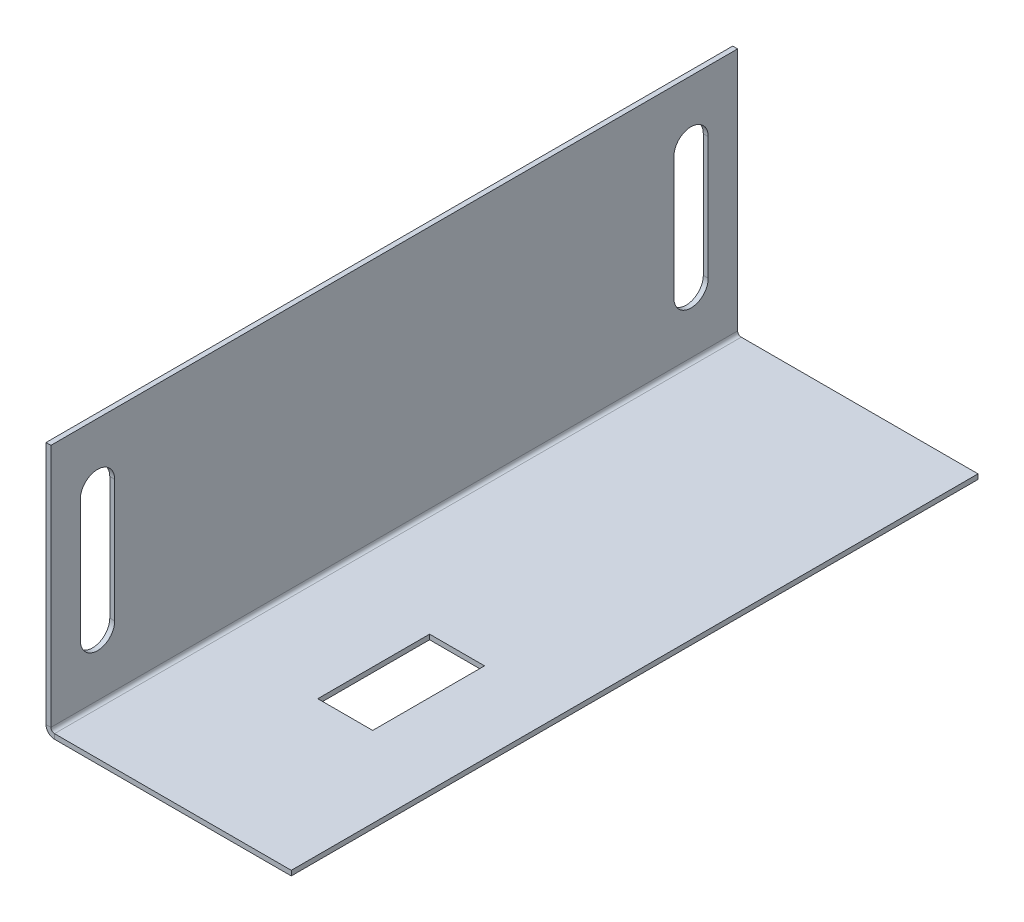
from build123d import *

# Parameters (mm, degrees)
SKETCH1_W              = 100
SKETCH1_H              = 140
BASE_FLANGE1_DEPTH     = 1
SKETCHED_START         = -140
SKETCHED_BEND1_DEPTH   = 140
SKETCHED_BEND1_2_DEPTH = 140
CUT_EXTRUDE1_REACH     = 158.698
CUT_EXTRUDE2_REACH     = 181.598
SKETCH17_W             = 11.2
SKETCH17_H             = 22.8


# Read off the part's stored shape, not the designer's step: Sketched Bend1
# Sheet-metal steps are written as plain solids
with BuildPart() as part:
    # Sketch1 → Base-Flange1 (new body)
    with BuildSketch(Plane(origin=(0, 0, 0), x_dir=(1, 0, 0), z_dir=(0, 1, 0))):
        with Locations((50, 70)):
            Rectangle(SKETCH1_W, SKETCH1_H)
    extrude(amount=-BASE_FLANGE1_DEPTH)

    # Sketched Bend1 outline → Sketched Bend1 (cut)
    with BuildSketch(Plane.XY.offset(SKETCHED_START)):
        with BuildLine():
            ThreePointArc((51.7366, -1), (50.804773836, -0.728828115), (50.16395891, 0))
            Line((50.16395891, 0), (0, 0))
            Line((0, 0), (0, -1))
            Line((0, -1), (51.7366, -1))
        make_face()
    extrude(amount=SKETCHED_BEND1_DEPTH, mode=Mode.SUBTRACT)

    # Sketched Bend1 2 outline → Sketched Bend1 2 (add)
    with BuildSketch(Plane.XY.offset(SKETCHED_START)):
        with BuildLine():
            Line((51, 50.530753262), (50, 50.530753262))
            Line((50, 50.530753262), (50, 0.7366))
            ThreePointArc((50, 0.7366), (50.041485243, 0.359286442), (50.16395891, 0))
            Line((50.16395891, 0), (51.7366, 0))
            ThreePointArc((51.7366, 0), (51.215745145, 0.215745145), (51, 0.7366))
            Line((51, 0.7366), (51, 50.530753262))
        make_face()
    extrude(amount=SKETCHED_BEND1_2_DEPTH)

    # Sketch14 → Cut-Extrude1 (cut, up to next)
    with BuildSketch(Plane(origin=(51, 0, 0), x_dir=(0, 0, -1), z_dir=(1, 0, 0)), mode=Mode.PRIVATE) as cut_extrude1_sk1:
        with BuildLine():
            Line((13, 38.030753262), (13, 13.030753262))
            ThreePointArc((13, 13.030753262), (9.5, 9.530753262), (6, 13.030753262))
            Line((6, 13.030753262), (6, 38.030753262))
            ThreePointArc((6, 38.030753262), (9.5, 41.530753262), (13, 38.030753262))
        make_face()
    cut_extrude1_tool1 = extrude(cut_extrude1_sk1.sketch, amount=-CUT_EXTRUDE1_REACH, mode=Mode.PRIVATE) & part.part
    # Sketch14 → Cut-Extrude1 (cut, up to next)
    with BuildSketch(Plane(origin=(51, 0, 0), x_dir=(0, 0, -1), z_dir=(1, 0, 0)), mode=Mode.PRIVATE) as cut_extrude1_sk2:
        with BuildLine():
            Line((127, 38.030753262), (127, 13.030753262))
            ThreePointArc((127, 13.030753262), (130.5, 9.530753262), (134, 13.030753262))
            Line((134, 13.030753262), (134, 38.030753262))
            ThreePointArc((134, 38.030753262), (130.5, 41.530753262), (127, 38.030753262))
        make_face()
    cut_extrude1_tool2 = extrude(cut_extrude1_sk2.sketch, amount=-CUT_EXTRUDE1_REACH, mode=Mode.PRIVATE) & part.part
    add(cut_extrude1_tool1.solids().sort_by_distance((51, 25.530753, -9.5))[0], mode=Mode.SUBTRACT)
    add(cut_extrude1_tool2.solids().sort_by_distance((51, 25.530753, -130.5))[0], mode=Mode.SUBTRACT)

    # Sketch17 → Cut-Extrude2 (cut, up to next)
    with BuildSketch(Plane.XZ.offset(1), mode=Mode.PRIVATE) as cut_extrude2_sk1:
        with Locations((78, -44.4)):
            Rectangle(SKETCH17_W, SKETCH17_H)
    cut_extrude2_tool1 = extrude(cut_extrude2_sk1.sketch, amount=-CUT_EXTRUDE2_REACH, mode=Mode.PRIVATE) & part.part
    add(cut_extrude2_tool1.solids().sort_by_distance((78, -1, -44.4))[0], mode=Mode.SUBTRACT)


solid = part.part
